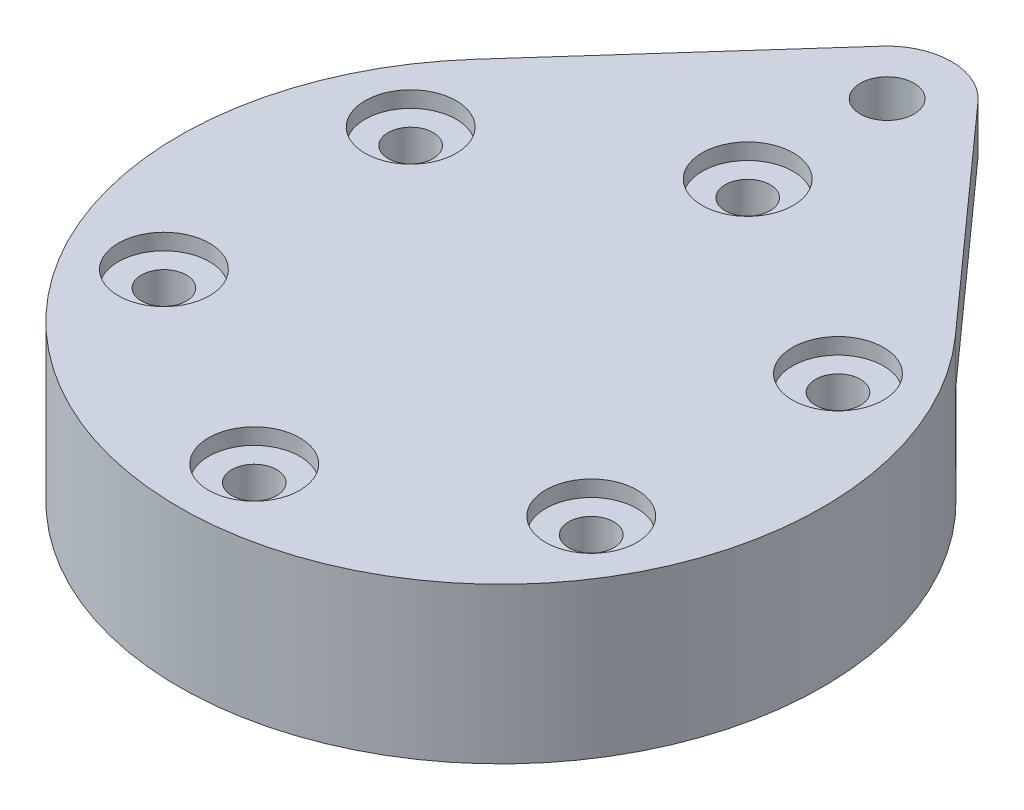
from build123d import *
from build123d.topology import SkipClean

# Parameters (mm, degrees)
SKETCH1_R           = 2.5
BOSS_EXTRUDE1_DEPTH = 4.5
SKETCH2_R           = 4.25
CUT_EXTRUDE1_DEPTH  = 1.5
BOSS_EXTRUDE2_START = 10
SKETCH3_R           = 30
BOSS_EXTRUDE2_DEPTH = 10
SKETCH4_R           = 2.1
CUT_EXTRUDE2_DEPTH  = 43


with BuildPart() as part:
    # Sketch1 → Boss-Extrude1 (new body)
    with BuildSketch(Plane(origin=(0, 0, 0), x_dir=(1, 0, 0), z_dir=(0, 1, 0))):
        with BuildLine():
            Line((-4.472135955, 40), (-22.360679775, 20))
            ThreePointArc((-22.360679775, 20), (0, -30), (22.360679775, 20))
            Line((22.360679775, 20), (4.472135955, 40))
            ThreePointArc((4.472135955, 40), (0, 42), (-4.472135955, 40))
        make_face()
        with Locations((0, 36)):
            Circle(SKETCH1_R, mode=Mode.SUBTRACT)
    extrude(amount=BOSS_EXTRUDE1_DEPTH)

    # Sketch2 → Cut-Extrude1 (cut)
    with BuildSketch(Plane(origin=(0, 4.5, 0), x_dir=(1, 0, 0), z_dir=(0, 1, 0))):
        with Locations((0, 23)):
            Circle(SKETCH2_R)
        with Locations((19.918584287, 11.5)):
            Circle(SKETCH2_R)
        with Locations((19.918584287, -11.5)):
            Circle(SKETCH2_R)
        with Locations((0, -23)):
            Circle(SKETCH2_R)
        with Locations((-19.918584287, -11.5)):
            Circle(SKETCH2_R)
        with Locations((-19.918584287, 11.5)):
            Circle(SKETCH2_R)
    extrude(amount=-CUT_EXTRUDE1_DEPTH, mode=Mode.SUBTRACT)

    # Sketch3 → Boss-Extrude2 (add)
    with SkipClean():  # the faces are left unmerged after this step: merging them gives an invalid solid
        with BuildSketch(Plane.XZ.offset(BOSS_EXTRUDE2_START)):
            Circle(SKETCH3_R)
        extrude(amount=-BOSS_EXTRUDE2_DEPTH)

    # Sketch4 → Cut-Extrude2 (cut)
    with SkipClean():  # the faces are left unmerged after this step: merging them gives an invalid solid
        with BuildSketch(Plane(origin=(0, 4.5, 0), x_dir=(1, 0, 0), z_dir=(0, 1, 0))):
            with Locations((0, 23)):
                Circle(SKETCH4_R)
            with Locations((19.918584287, 11.5)):
                Circle(SKETCH4_R)
            with Locations((19.918584287, -11.5)):
                Circle(SKETCH4_R)
            with Locations((0, -23)):
                Circle(SKETCH4_R)
            with Locations((-19.918584287, -11.5)):
                Circle(SKETCH4_R)
            with Locations((-19.918584287, 11.5)):
                Circle(SKETCH4_R)
        extrude(amount=-CUT_EXTRUDE2_DEPTH, mode=Mode.SUBTRACT)


solid = part.part
